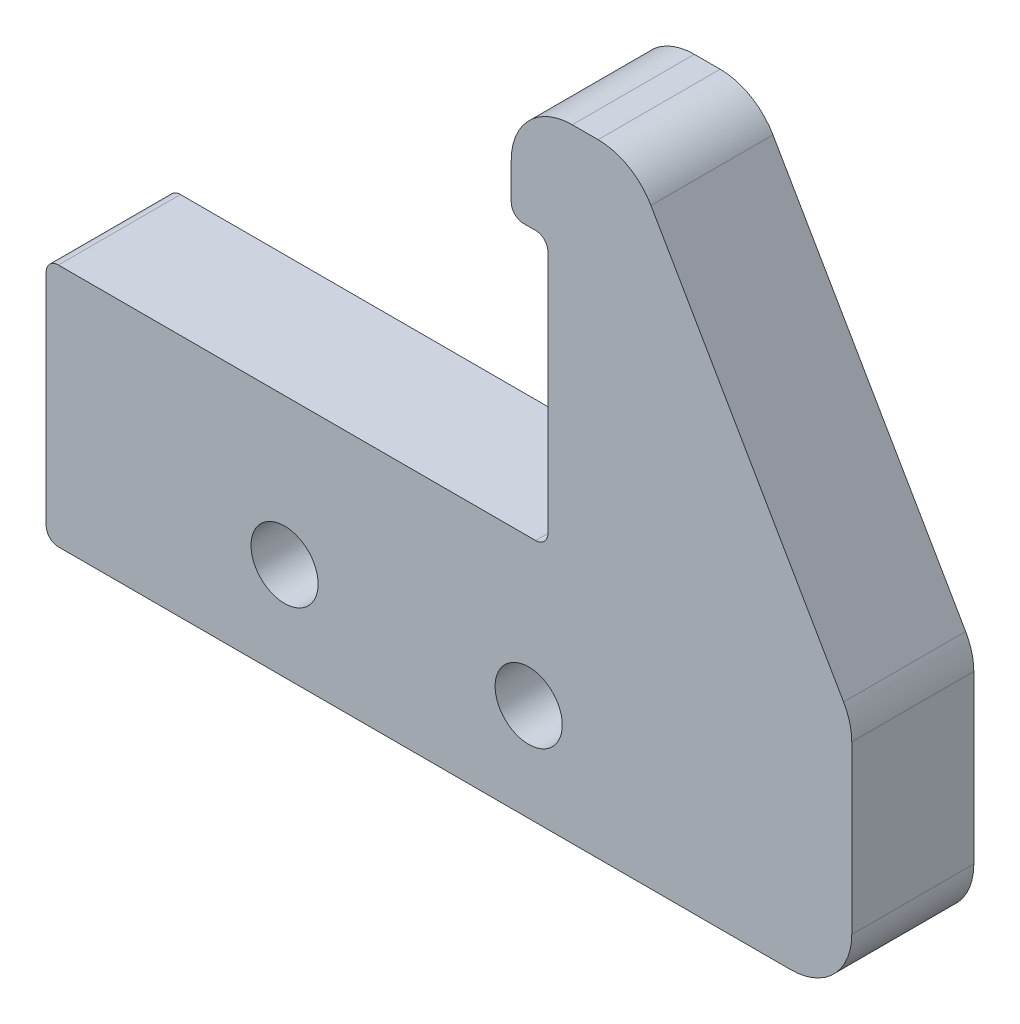
from build123d import *

# Parameters (mm, degrees)
BOSS_EXTRUDE1_DEPTH  = 10
FILLET1_R            = 5
FILLET2_R            = 1
M5_CLEARANCE_HOLE1_D = 5.5


with BuildPart() as part:
    # Sketch1 → Boss-Extrude1 (new body)
    with BuildSketch(Plane.XY):
        Polygon((-66, 20), (-24.897858345, 20), (-24.897858345, 42), (-27.897858345, 42), (-27.897858345, 51), (-17.897858345, 51), (0, 20), (0, 0), (-66, 0), align=None)
    extrude(amount=BOSS_EXTRUDE1_DEPTH)

    # Fillet1
    fillet1_edges = [part.edges().sort_by_distance(p)[0] for p in [
        (0, 0, 5),
        (0, 20, 5),
        (-17.897858345, 51, 5),
        (-27.897858345, 51, 5),
    ]]
    fillet(fillet1_edges, radius=FILLET1_R)

    # Fillet2
    fillet2_edges = [part.edges().sort_by_distance(p)[0] for p in [
        (-24.897858345, 20, 5),
        (-24.897858345, 42, 5),
        (-27.897858345, 42, 5),
        (-66, 0, 5),
        (-66, 20, 5),
    ]]
    fillet(fillet2_edges, radius=FILLET2_R)

    # M5 Clearance Hole1 (through all)
    with Locations(Plane.XY.offset(10)):
        with Locations((-26.47, 8), (-46.47, 8)):
            Hole(M5_CLEARANCE_HOLE1_D / 2)


solid = part.part
